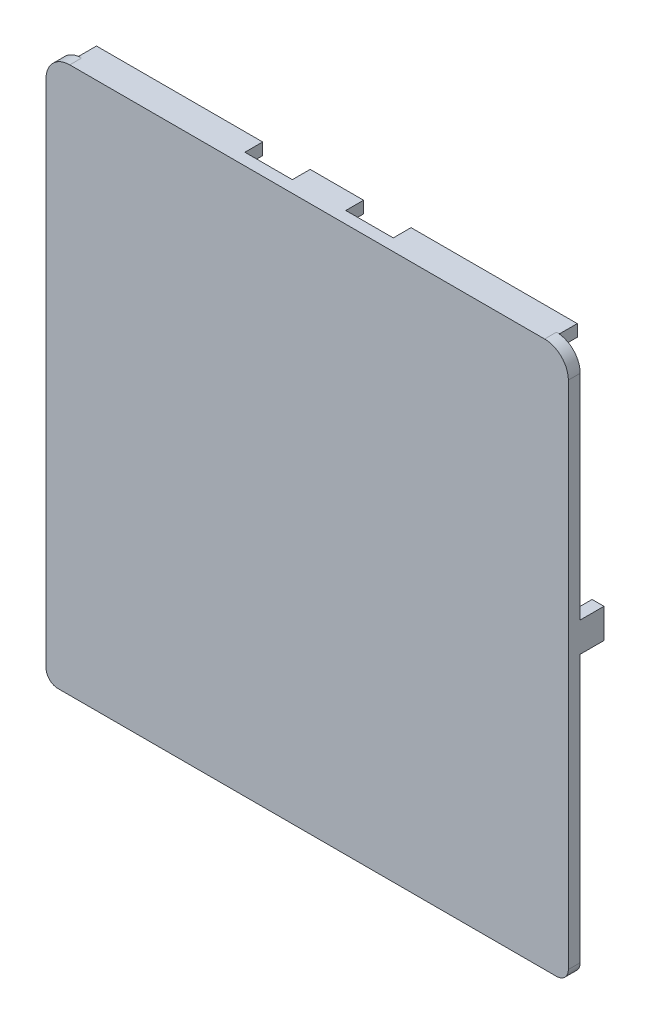
from build123d import *

# Parameters (mm, degrees)
SKETCH1_W           = 88
SKETCH1_H           = 92
BOSS_EXTRUDE1_DEPTH = 2
FILLET1_R           = 4
SKETCH3_W           = 28
SKETCH3_H           = 2
SKETCH3_W_2         = 9
BOSS_EXTRUDE3_DEPTH = 3
SKETCH4_W           = 2
SKETCH4_H           = 5
BOSS_EXTRUDE4_DEPTH = 4
FILLET2_R           = 2
BOSS_EXTRUDE5_DEPTH = 2
FILLET4_R           = 0.5


with BuildPart() as part:
    # Sketch1 → Boss-Extrude1 (new body)
    with BuildSketch(Plane.XY):
        with Locations((-29.854657196, 17.8829867)):
            Rectangle(SKETCH1_W, SKETCH1_H)
    extrude(amount=BOSS_EXTRUDE1_DEPTH)

    # Fillet1
    fillet1_edges = [part.edges().sort_by_distance(p)[0] for p in [
        (-73.854657196, 63.8829867, 1),
        (14.145342804, 63.8829867, 1),
    ]]
    fillet(fillet1_edges, radius=FILLET1_R)

    # Sketch3 → Boss-Extrude3 (add)
    with BuildSketch(Plane(origin=(0, 0, 0), x_dir=(-1, 0, 0), z_dir=(0, 0, -1))):
        with Locations((56.354657196, 62.8829867)):
            Rectangle(SKETCH3_W, SKETCH3_H)
        with Locations((29.854657196, 62.8829867)):
            Rectangle(SKETCH3_W_2, SKETCH3_H)
        with Locations((3.354657196, 62.8829867)):
            Rectangle(SKETCH3_W, SKETCH3_H)
    extrude(amount=BOSS_EXTRUDE3_DEPTH)

    # Sketch4 → Boss-Extrude4 (add)
    with BuildSketch(Plane(origin=(0, 0, 0), x_dir=(-1, 0, 0), z_dir=(0, 0, -1))):
        with Locations((-13.145342804, 21.3829867)):
            Rectangle(SKETCH4_W, SKETCH4_H)
    extrude(amount=BOSS_EXTRUDE4_DEPTH)

    # Fillet2
    fillet2_edges = [part.edges().sort_by_distance(p)[0] for p in [
        (14.145342804, -28.1170133, 1),
        (-73.854657196, -28.1170133, 1),
    ]]
    fillet(fillet2_edges, radius=FILLET2_R)

    # Sketch5 → Boss-Extrude5 (add)
    with BuildSketch(Plane(origin=(0, 0, 0), x_dir=(-1, 0, 0), z_dir=(0, 0, -1))):
        Polygon((71.854657196, -26.1170133), (68.854657196, -26.1170133), (-12.145342804, -26.1170133), (-12.145342804, -23.1170133), (-12.145342804, 54.889958553), (-9.145342804, 54.889958553), (-9.145342804, -23.1170133), (68.854657196, -23.1170133), (68.854657196, 54.749214955), (71.854657196, 54.749214955), align=None)
    extrude(amount=BOSS_EXTRUDE5_DEPTH)

    # Fillet4
    fillet4_edges = [part.edges().sort_by_distance(p)[0] for p in [
        (-71.854657196, 14.316100828, -2),
        (-29.854657196, -26.1170133, -2),
        (12.145342804, -3.6170133, -2),
        (12.145342804, 39.386472626, -2),
    ]]
    fillet(fillet4_edges, radius=FILLET4_R)


solid = part.part
